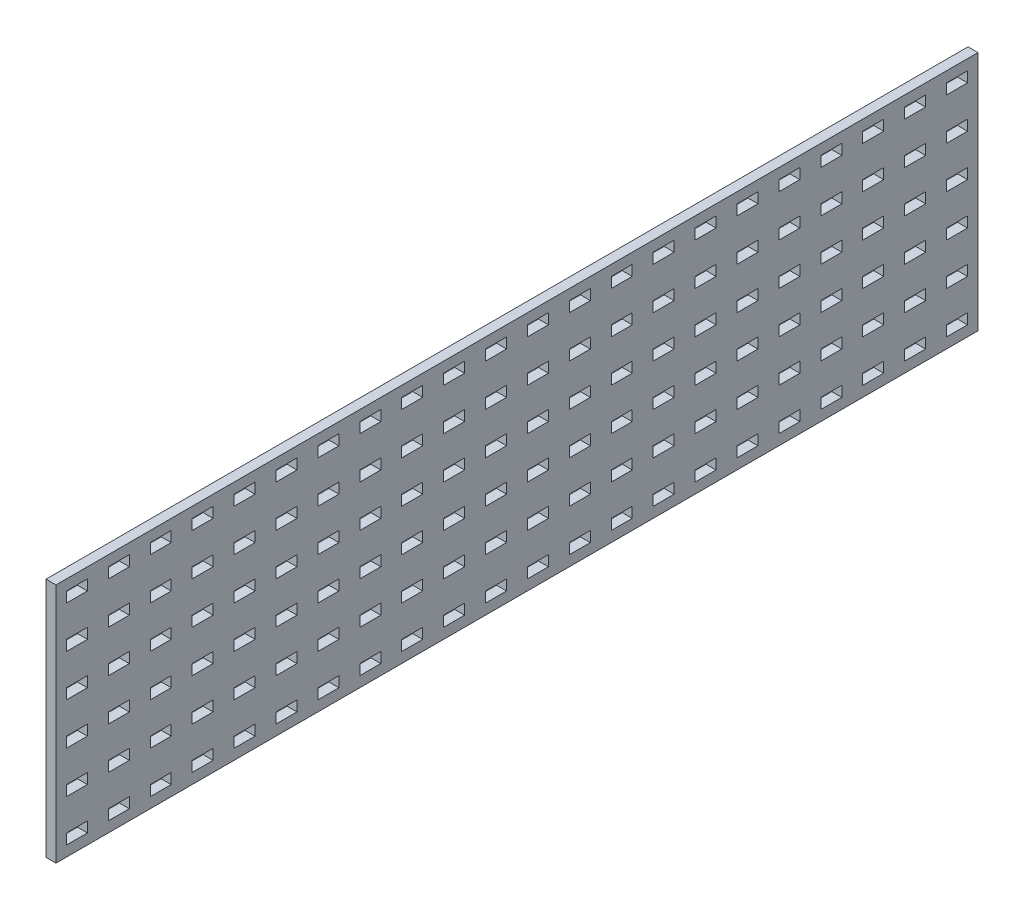
from build123d import *

# Parameters (mm, degrees)
SKETCH1_W           = 558.8
SKETCH1_H           = 146.05
BOSS_EXTRUDE1_DEPTH = 3.0226
SKETCH2_W           = 12.7
SKETCH2_H           = 6.35
CUT_EXTRUDE1_DEPTH  = 289.84867157


with BuildPart() as part:
    # Sketch1 → Boss-Extrude1 (new, symmetric)
    with BuildSketch(Plane(origin=(0, 0, 0), x_dir=(0, 0, -1), z_dir=(1, 0, 0))):
        Rectangle(SKETCH1_W, SKETCH1_H)
    extrude(amount=BOSS_EXTRUDE1_DEPTH, both=True)

    # Sketch2 → Cut-Extrude1 (cut, through all)
    with BuildSketch(Plane(origin=(3.0226, 0, 0), x_dir=(0, 0, -1), z_dir=(1, 0, 0))):
        with Locations((266.7, -63.5)):
            Rectangle(SKETCH2_W, SKETCH2_H)
        with Locations((241.3, -63.5)):
            Rectangle(SKETCH2_W, SKETCH2_H)
        with Locations((215.9, -63.5)):
            Rectangle(SKETCH2_W, SKETCH2_H)
        with Locations((190.5, -63.5)):
            Rectangle(SKETCH2_W, SKETCH2_H)
        with Locations((165.1, -63.5)):
            Rectangle(SKETCH2_W, SKETCH2_H)
        with Locations((139.7, -63.5)):
            Rectangle(SKETCH2_W, SKETCH2_H)
        with Locations((114.3, -63.5)):
            Rectangle(SKETCH2_W, SKETCH2_H)
        with Locations((88.9, -63.5)):
            Rectangle(SKETCH2_W, SKETCH2_H)
        with Locations((63.5, -63.5)):
            Rectangle(SKETCH2_W, SKETCH2_H)
        with Locations((38.1, -63.5)):
            Rectangle(SKETCH2_W, SKETCH2_H)
        with Locations((12.7, -63.5)):
            Rectangle(SKETCH2_W, SKETCH2_H)
        with Locations((-12.7, -63.5)):
            Rectangle(SKETCH2_W, SKETCH2_H)
        with Locations((-38.1, -63.5)):
            Rectangle(SKETCH2_W, SKETCH2_H)
        with Locations((-63.5, -63.5)):
            Rectangle(SKETCH2_W, SKETCH2_H)
        with Locations((-88.9, -63.5)):
            Rectangle(SKETCH2_W, SKETCH2_H)
        with Locations((-114.3, -63.5)):
            Rectangle(SKETCH2_W, SKETCH2_H)
        with Locations((-139.7, -63.5)):
            Rectangle(SKETCH2_W, SKETCH2_H)
        with Locations((-165.1, -63.5)):
            Rectangle(SKETCH2_W, SKETCH2_H)
        with Locations((-190.5, -63.5)):
            Rectangle(SKETCH2_W, SKETCH2_H)
        with Locations((-215.9, -63.5)):
            Rectangle(SKETCH2_W, SKETCH2_H)
        with Locations((-241.3, -63.5)):
            Rectangle(SKETCH2_W, SKETCH2_H)
        with Locations((-266.7, -63.5)):
            Rectangle(SKETCH2_W, SKETCH2_H)
        with Locations((241.3, -38.1)):
            Rectangle(SKETCH2_W, SKETCH2_H)
        with Locations((215.9, -38.1)):
            Rectangle(SKETCH2_W, SKETCH2_H)
        with Locations((190.5, -38.1)):
            Rectangle(SKETCH2_W, SKETCH2_H)
        with Locations((165.1, -38.1)):
            Rectangle(SKETCH2_W, SKETCH2_H)
        with Locations((139.7, -38.1)):
            Rectangle(SKETCH2_W, SKETCH2_H)
        with Locations((114.3, -38.1)):
            Rectangle(SKETCH2_W, SKETCH2_H)
        with Locations((88.9, -38.1)):
            Rectangle(SKETCH2_W, SKETCH2_H)
        with Locations((63.5, -38.1)):
            Rectangle(SKETCH2_W, SKETCH2_H)
        with Locations((38.1, -38.1)):
            Rectangle(SKETCH2_W, SKETCH2_H)
        with Locations((12.7, -38.1)):
            Rectangle(SKETCH2_W, SKETCH2_H)
        with Locations((-12.7, -38.1)):
            Rectangle(SKETCH2_W, SKETCH2_H)
        with Locations((-38.1, -38.1)):
            Rectangle(SKETCH2_W, SKETCH2_H)
        with Locations((-63.5, -38.1)):
            Rectangle(SKETCH2_W, SKETCH2_H)
        with Locations((-88.9, -38.1)):
            Rectangle(SKETCH2_W, SKETCH2_H)
        with Locations((-114.3, -38.1)):
            Rectangle(SKETCH2_W, SKETCH2_H)
        with Locations((-139.7, -38.1)):
            Rectangle(SKETCH2_W, SKETCH2_H)
        with Locations((-165.1, -38.1)):
            Rectangle(SKETCH2_W, SKETCH2_H)
        with Locations((-190.5, -38.1)):
            Rectangle(SKETCH2_W, SKETCH2_H)
        with Locations((-215.9, -38.1)):
            Rectangle(SKETCH2_W, SKETCH2_H)
        with Locations((-241.3, -38.1)):
            Rectangle(SKETCH2_W, SKETCH2_H)
        with Locations((-266.7, -38.1)):
            Rectangle(SKETCH2_W, SKETCH2_H)
        with Locations((241.3, -12.7)):
            Rectangle(SKETCH2_W, SKETCH2_H)
        with Locations((215.9, -12.7)):
            Rectangle(SKETCH2_W, SKETCH2_H)
        with Locations((190.5, -12.7)):
            Rectangle(SKETCH2_W, SKETCH2_H)
        with Locations((165.1, -12.7)):
            Rectangle(SKETCH2_W, SKETCH2_H)
        with Locations((139.7, -12.7)):
            Rectangle(SKETCH2_W, SKETCH2_H)
        with Locations((114.3, -12.7)):
            Rectangle(SKETCH2_W, SKETCH2_H)
        with Locations((88.9, -12.7)):
            Rectangle(SKETCH2_W, SKETCH2_H)
        with Locations((63.5, -12.7)):
            Rectangle(SKETCH2_W, SKETCH2_H)
        with Locations((38.1, -12.7)):
            Rectangle(SKETCH2_W, SKETCH2_H)
        with Locations((12.7, -12.7)):
            Rectangle(SKETCH2_W, SKETCH2_H)
        with Locations((-12.7, -12.7)):
            Rectangle(SKETCH2_W, SKETCH2_H)
        with Locations((-38.1, -12.7)):
            Rectangle(SKETCH2_W, SKETCH2_H)
        with Locations((-63.5, -12.7)):
            Rectangle(SKETCH2_W, SKETCH2_H)
        with Locations((-88.9, -12.7)):
            Rectangle(SKETCH2_W, SKETCH2_H)
        with Locations((-114.3, -12.7)):
            Rectangle(SKETCH2_W, SKETCH2_H)
        with Locations((-139.7, -12.7)):
            Rectangle(SKETCH2_W, SKETCH2_H)
        with Locations((-165.1, -12.7)):
            Rectangle(SKETCH2_W, SKETCH2_H)
        with Locations((-190.5, -12.7)):
            Rectangle(SKETCH2_W, SKETCH2_H)
        with Locations((-215.9, -12.7)):
            Rectangle(SKETCH2_W, SKETCH2_H)
        with Locations((-241.3, -12.7)):
            Rectangle(SKETCH2_W, SKETCH2_H)
        with Locations((-266.7, -12.7)):
            Rectangle(SKETCH2_W, SKETCH2_H)
        with Locations((241.3, 12.7)):
            Rectangle(SKETCH2_W, SKETCH2_H)
        with Locations((215.9, 12.7)):
            Rectangle(SKETCH2_W, SKETCH2_H)
        with Locations((190.5, 12.7)):
            Rectangle(SKETCH2_W, SKETCH2_H)
        with Locations((165.1, 12.7)):
            Rectangle(SKETCH2_W, SKETCH2_H)
        with Locations((139.7, 12.7)):
            Rectangle(SKETCH2_W, SKETCH2_H)
        with Locations((114.3, 12.7)):
            Rectangle(SKETCH2_W, SKETCH2_H)
        with Locations((88.9, 12.7)):
            Rectangle(SKETCH2_W, SKETCH2_H)
        with Locations((63.5, 12.7)):
            Rectangle(SKETCH2_W, SKETCH2_H)
        with Locations((38.1, 12.7)):
            Rectangle(SKETCH2_W, SKETCH2_H)
        with Locations((12.7, 12.7)):
            Rectangle(SKETCH2_W, SKETCH2_H)
        with Locations((-12.7, 12.7)):
            Rectangle(SKETCH2_W, SKETCH2_H)
        with Locations((-38.1, 12.7)):
            Rectangle(SKETCH2_W, SKETCH2_H)
        with Locations((-63.5, 12.7)):
            Rectangle(SKETCH2_W, SKETCH2_H)
        with Locations((-88.9, 12.7)):
            Rectangle(SKETCH2_W, SKETCH2_H)
        with Locations((-114.3, 12.7)):
            Rectangle(SKETCH2_W, SKETCH2_H)
        with Locations((-139.7, 12.7)):
            Rectangle(SKETCH2_W, SKETCH2_H)
        with Locations((-165.1, 12.7)):
            Rectangle(SKETCH2_W, SKETCH2_H)
        with Locations((-190.5, 12.7)):
            Rectangle(SKETCH2_W, SKETCH2_H)
        with Locations((-215.9, 12.7)):
            Rectangle(SKETCH2_W, SKETCH2_H)
        with Locations((-241.3, 12.7)):
            Rectangle(SKETCH2_W, SKETCH2_H)
        with Locations((-266.7, 12.7)):
            Rectangle(SKETCH2_W, SKETCH2_H)
        with Locations((241.3, 38.1)):
            Rectangle(SKETCH2_W, SKETCH2_H)
        with Locations((215.9, 38.1)):
            Rectangle(SKETCH2_W, SKETCH2_H)
        with Locations((190.5, 38.1)):
            Rectangle(SKETCH2_W, SKETCH2_H)
        with Locations((165.1, 38.1)):
            Rectangle(SKETCH2_W, SKETCH2_H)
        with Locations((139.7, 38.1)):
            Rectangle(SKETCH2_W, SKETCH2_H)
        with Locations((114.3, 38.1)):
            Rectangle(SKETCH2_W, SKETCH2_H)
        with Locations((88.9, 38.1)):
            Rectangle(SKETCH2_W, SKETCH2_H)
        with Locations((63.5, 38.1)):
            Rectangle(SKETCH2_W, SKETCH2_H)
        with Locations((38.1, 38.1)):
            Rectangle(SKETCH2_W, SKETCH2_H)
        with Locations((12.7, 38.1)):
            Rectangle(SKETCH2_W, SKETCH2_H)
        with Locations((-12.7, 38.1)):
            Rectangle(SKETCH2_W, SKETCH2_H)
        with Locations((-38.1, 38.1)):
            Rectangle(SKETCH2_W, SKETCH2_H)
        with Locations((-63.5, 38.1)):
            Rectangle(SKETCH2_W, SKETCH2_H)
        with Locations((-88.9, 38.1)):
            Rectangle(SKETCH2_W, SKETCH2_H)
        with Locations((-114.3, 38.1)):
            Rectangle(SKETCH2_W, SKETCH2_H)
        with Locations((-139.7, 38.1)):
            Rectangle(SKETCH2_W, SKETCH2_H)
        with Locations((-165.1, 38.1)):
            Rectangle(SKETCH2_W, SKETCH2_H)
        with Locations((-190.5, 38.1)):
            Rectangle(SKETCH2_W, SKETCH2_H)
        with Locations((-215.9, 38.1)):
            Rectangle(SKETCH2_W, SKETCH2_H)
        with Locations((-241.3, 38.1)):
            Rectangle(SKETCH2_W, SKETCH2_H)
        with Locations((-266.7, 38.1)):
            Rectangle(SKETCH2_W, SKETCH2_H)
        with Locations((241.3, 63.5)):
            Rectangle(SKETCH2_W, SKETCH2_H)
        with Locations((215.9, 63.5)):
            Rectangle(SKETCH2_W, SKETCH2_H)
        with Locations((190.5, 63.5)):
            Rectangle(SKETCH2_W, SKETCH2_H)
        with Locations((165.1, 63.5)):
            Rectangle(SKETCH2_W, SKETCH2_H)
        with Locations((139.7, 63.5)):
            Rectangle(SKETCH2_W, SKETCH2_H)
        with Locations((114.3, 63.5)):
            Rectangle(SKETCH2_W, SKETCH2_H)
        with Locations((88.9, 63.5)):
            Rectangle(SKETCH2_W, SKETCH2_H)
        with Locations((63.5, 63.5)):
            Rectangle(SKETCH2_W, SKETCH2_H)
        with Locations((38.1, 63.5)):
            Rectangle(SKETCH2_W, SKETCH2_H)
        with Locations((12.7, 63.5)):
            Rectangle(SKETCH2_W, SKETCH2_H)
        with Locations((-12.7, 63.5)):
            Rectangle(SKETCH2_W, SKETCH2_H)
        with Locations((-38.1, 63.5)):
            Rectangle(SKETCH2_W, SKETCH2_H)
        with Locations((-63.5, 63.5)):
            Rectangle(SKETCH2_W, SKETCH2_H)
        with Locations((-88.9, 63.5)):
            Rectangle(SKETCH2_W, SKETCH2_H)
        with Locations((-114.3, 63.5)):
            Rectangle(SKETCH2_W, SKETCH2_H)
        with Locations((-139.7, 63.5)):
            Rectangle(SKETCH2_W, SKETCH2_H)
        with Locations((-165.1, 63.5)):
            Rectangle(SKETCH2_W, SKETCH2_H)
        with Locations((-190.5, 63.5)):
            Rectangle(SKETCH2_W, SKETCH2_H)
        with Locations((-215.9, 63.5)):
            Rectangle(SKETCH2_W, SKETCH2_H)
        with Locations((-241.3, 63.5)):
            Rectangle(SKETCH2_W, SKETCH2_H)
        with Locations((-266.7, 63.5)):
            Rectangle(SKETCH2_W, SKETCH2_H)
        with Locations((241.3, 88.9)):
            Rectangle(SKETCH2_W, SKETCH2_H)
        with Locations((215.9, 88.9)):
            Rectangle(SKETCH2_W, SKETCH2_H)
        with Locations((190.5, 88.9)):
            Rectangle(SKETCH2_W, SKETCH2_H)
        with Locations((165.1, 88.9)):
            Rectangle(SKETCH2_W, SKETCH2_H)
        with Locations((139.7, 88.9)):
            Rectangle(SKETCH2_W, SKETCH2_H)
        with Locations((114.3, 88.9)):
            Rectangle(SKETCH2_W, SKETCH2_H)
        with Locations((88.9, 88.9)):
            Rectangle(SKETCH2_W, SKETCH2_H)
        with Locations((63.5, 88.9)):
            Rectangle(SKETCH2_W, SKETCH2_H)
        with Locations((38.1, 88.9)):
            Rectangle(SKETCH2_W, SKETCH2_H)
        with Locations((12.7, 88.9)):
            Rectangle(SKETCH2_W, SKETCH2_H)
        with Locations((-12.7, 88.9)):
            Rectangle(SKETCH2_W, SKETCH2_H)
        with Locations((-38.1, 88.9)):
            Rectangle(SKETCH2_W, SKETCH2_H)
        with Locations((-63.5, 88.9)):
            Rectangle(SKETCH2_W, SKETCH2_H)
        with Locations((-88.9, 88.9)):
            Rectangle(SKETCH2_W, SKETCH2_H)
        with Locations((-114.3, 88.9)):
            Rectangle(SKETCH2_W, SKETCH2_H)
        with Locations((-139.7, 88.9)):
            Rectangle(SKETCH2_W, SKETCH2_H)
        with Locations((-165.1, 88.9)):
            Rectangle(SKETCH2_W, SKETCH2_H)
        with Locations((-190.5, 88.9)):
            Rectangle(SKETCH2_W, SKETCH2_H)
        with Locations((-215.9, 88.9)):
            Rectangle(SKETCH2_W, SKETCH2_H)
        with Locations((-241.3, 88.9)):
            Rectangle(SKETCH2_W, SKETCH2_H)
        with Locations((-266.7, 88.9)):
            Rectangle(SKETCH2_W, SKETCH2_H)
        with Locations((241.3, 114.3)):
            Rectangle(SKETCH2_W, SKETCH2_H)
        with Locations((215.9, 114.3)):
            Rectangle(SKETCH2_W, SKETCH2_H)
        with Locations((190.5, 114.3)):
            Rectangle(SKETCH2_W, SKETCH2_H)
        with Locations((165.1, 114.3)):
            Rectangle(SKETCH2_W, SKETCH2_H)
        with Locations((139.7, 114.3)):
            Rectangle(SKETCH2_W, SKETCH2_H)
        with Locations((114.3, 114.3)):
            Rectangle(SKETCH2_W, SKETCH2_H)
        with Locations((88.9, 114.3)):
            Rectangle(SKETCH2_W, SKETCH2_H)
        with Locations((63.5, 114.3)):
            Rectangle(SKETCH2_W, SKETCH2_H)
        with Locations((38.1, 114.3)):
            Rectangle(SKETCH2_W, SKETCH2_H)
        with Locations((12.7, 114.3)):
            Rectangle(SKETCH2_W, SKETCH2_H)
        with Locations((-12.7, 114.3)):
            Rectangle(SKETCH2_W, SKETCH2_H)
        with Locations((-38.1, 114.3)):
            Rectangle(SKETCH2_W, SKETCH2_H)
        with Locations((-63.5, 114.3)):
            Rectangle(SKETCH2_W, SKETCH2_H)
        with Locations((-88.9, 114.3)):
            Rectangle(SKETCH2_W, SKETCH2_H)
        with Locations((-114.3, 114.3)):
            Rectangle(SKETCH2_W, SKETCH2_H)
        with Locations((-139.7, 114.3)):
            Rectangle(SKETCH2_W, SKETCH2_H)
        with Locations((-165.1, 114.3)):
            Rectangle(SKETCH2_W, SKETCH2_H)
        with Locations((-190.5, 114.3)):
            Rectangle(SKETCH2_W, SKETCH2_H)
        with Locations((-215.9, 114.3)):
            Rectangle(SKETCH2_W, SKETCH2_H)
        with Locations((-241.3, 114.3)):
            Rectangle(SKETCH2_W, SKETCH2_H)
        with Locations((-266.7, 114.3)):
            Rectangle(SKETCH2_W, SKETCH2_H)
        with Locations((241.3, 139.7)):
            Rectangle(SKETCH2_W, SKETCH2_H)
        with Locations((215.9, 139.7)):
            Rectangle(SKETCH2_W, SKETCH2_H)
        with Locations((190.5, 139.7)):
            Rectangle(SKETCH2_W, SKETCH2_H)
        with Locations((165.1, 139.7)):
            Rectangle(SKETCH2_W, SKETCH2_H)
        with Locations((139.7, 139.7)):
            Rectangle(SKETCH2_W, SKETCH2_H)
        with Locations((114.3, 139.7)):
            Rectangle(SKETCH2_W, SKETCH2_H)
        with Locations((88.9, 139.7)):
            Rectangle(SKETCH2_W, SKETCH2_H)
        with Locations((63.5, 139.7)):
            Rectangle(SKETCH2_W, SKETCH2_H)
        with Locations((38.1, 139.7)):
            Rectangle(SKETCH2_W, SKETCH2_H)
        with Locations((12.7, 139.7)):
            Rectangle(SKETCH2_W, SKETCH2_H)
        with Locations((-12.7, 139.7)):
            Rectangle(SKETCH2_W, SKETCH2_H)
        with Locations((-38.1, 139.7)):
            Rectangle(SKETCH2_W, SKETCH2_H)
        with Locations((-63.5, 139.7)):
            Rectangle(SKETCH2_W, SKETCH2_H)
        with Locations((-88.9, 139.7)):
            Rectangle(SKETCH2_W, SKETCH2_H)
        with Locations((-114.3, 139.7)):
            Rectangle(SKETCH2_W, SKETCH2_H)
        with Locations((-139.7, 139.7)):
            Rectangle(SKETCH2_W, SKETCH2_H)
        with Locations((-165.1, 139.7)):
            Rectangle(SKETCH2_W, SKETCH2_H)
        with Locations((-190.5, 139.7)):
            Rectangle(SKETCH2_W, SKETCH2_H)
        with Locations((-215.9, 139.7)):
            Rectangle(SKETCH2_W, SKETCH2_H)
        with Locations((-241.3, 139.7)):
            Rectangle(SKETCH2_W, SKETCH2_H)
        with Locations((-266.7, 139.7)):
            Rectangle(SKETCH2_W, SKETCH2_H)
        with Locations((241.3, 165.1)):
            Rectangle(SKETCH2_W, SKETCH2_H)
        with Locations((215.9, 165.1)):
            Rectangle(SKETCH2_W, SKETCH2_H)
        with Locations((190.5, 165.1)):
            Rectangle(SKETCH2_W, SKETCH2_H)
        with Locations((165.1, 165.1)):
            Rectangle(SKETCH2_W, SKETCH2_H)
        with Locations((139.7, 165.1)):
            Rectangle(SKETCH2_W, SKETCH2_H)
        with Locations((114.3, 165.1)):
            Rectangle(SKETCH2_W, SKETCH2_H)
        with Locations((88.9, 165.1)):
            Rectangle(SKETCH2_W, SKETCH2_H)
        with Locations((63.5, 165.1)):
            Rectangle(SKETCH2_W, SKETCH2_H)
        with Locations((38.1, 165.1)):
            Rectangle(SKETCH2_W, SKETCH2_H)
        with Locations((12.7, 165.1)):
            Rectangle(SKETCH2_W, SKETCH2_H)
        with Locations((-12.7, 165.1)):
            Rectangle(SKETCH2_W, SKETCH2_H)
        with Locations((-38.1, 165.1)):
            Rectangle(SKETCH2_W, SKETCH2_H)
        with Locations((-63.5, 165.1)):
            Rectangle(SKETCH2_W, SKETCH2_H)
        with Locations((-88.9, 165.1)):
            Rectangle(SKETCH2_W, SKETCH2_H)
        with Locations((-114.3, 165.1)):
            Rectangle(SKETCH2_W, SKETCH2_H)
        with Locations((-139.7, 165.1)):
            Rectangle(SKETCH2_W, SKETCH2_H)
        with Locations((-165.1, 165.1)):
            Rectangle(SKETCH2_W, SKETCH2_H)
        with Locations((-190.5, 165.1)):
            Rectangle(SKETCH2_W, SKETCH2_H)
        with Locations((-215.9, 165.1)):
            Rectangle(SKETCH2_W, SKETCH2_H)
        with Locations((-241.3, 165.1)):
            Rectangle(SKETCH2_W, SKETCH2_H)
        with Locations((-266.7, 165.1)):
            Rectangle(SKETCH2_W, SKETCH2_H)
        with Locations((266.7, -38.1)):
            Rectangle(SKETCH2_W, SKETCH2_H)
        with Locations((266.7, -12.7)):
            Rectangle(SKETCH2_W, SKETCH2_H)
        with Locations((266.7, 12.7)):
            Rectangle(SKETCH2_W, SKETCH2_H)
        with Locations((266.7, 38.1)):
            Rectangle(SKETCH2_W, SKETCH2_H)
        with Locations((266.7, 63.5)):
            Rectangle(SKETCH2_W, SKETCH2_H)
        with Locations((266.7, 88.9)):
            Rectangle(SKETCH2_W, SKETCH2_H)
        with Locations((266.7, 114.3)):
            Rectangle(SKETCH2_W, SKETCH2_H)
        with Locations((266.7, 139.7)):
            Rectangle(SKETCH2_W, SKETCH2_H)
        with Locations((266.7, 165.1)):
            Rectangle(SKETCH2_W, SKETCH2_H)
    extrude(amount=-CUT_EXTRUDE1_DEPTH, mode=Mode.SUBTRACT)


solid = part.part
